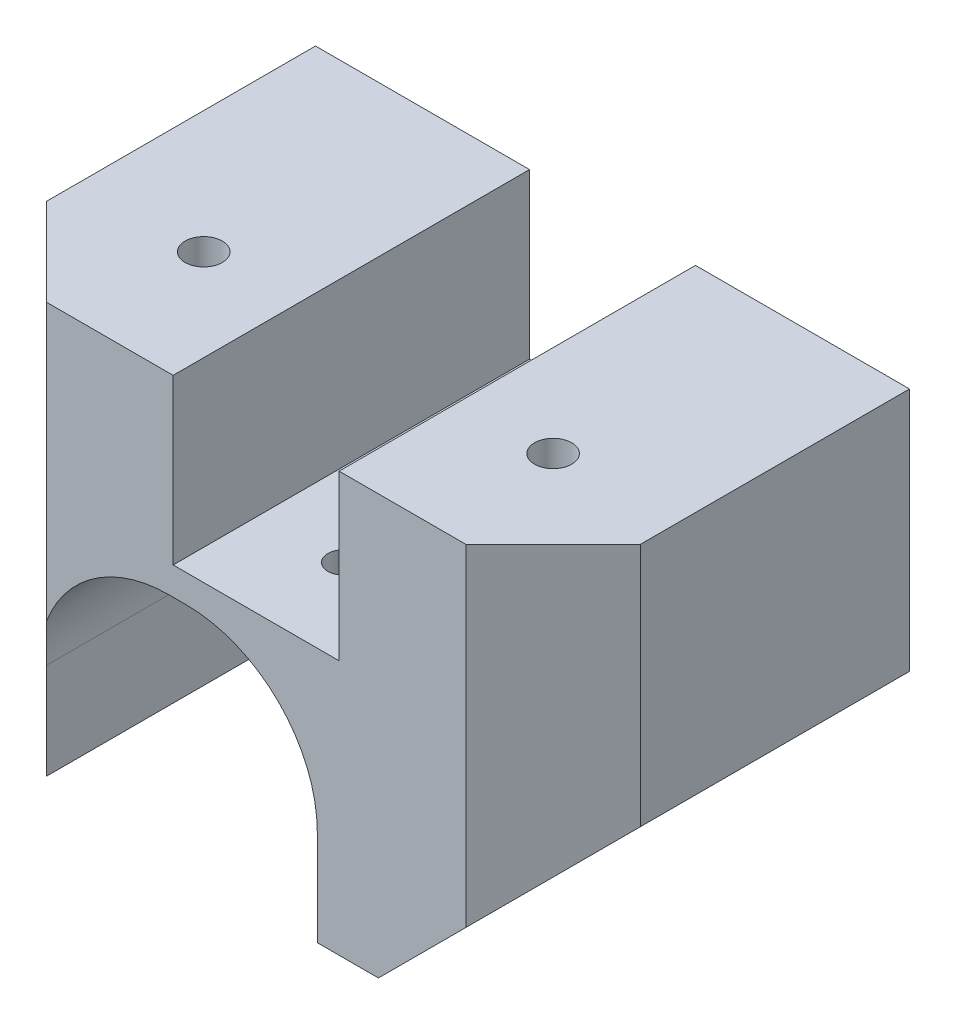
from build123d import *

# Parameters (mm, degrees)
SKETCH1_W                 = 43.18
SKETCH1_H                 = 25.908
BOSS_EXTRUDE1_DEPTH       = 30.48
SIDECHAMFER_SIZE          = 12.7
BACKCHAMFERS_SIZE         = 6.35
SKETCH2_W                 = 12.065
SKETCH2_H                 = 11.938
LINACTSLOT_DEPTH          = 46.457485236
MOUTINGHOLES_D            = 2.7051
MOUTINGHOLES_DEPTH        = 14.478
MOUTINGHOLES_TIP          = 0.81269403
CUT_EXTRUDE1_DEPTH        = 46.457485236
MOTORMOUNTINGHOLES2_D     = 2.2606
MOTORMOUNTINGHOLES2_DEPTH = 11.43
MOTORMOUNTINGHOLES2_TIP   = 0.679152758
GRIPPERSETSCREW_D         = 2.2606


with BuildPart() as part:
    # Sketch1 → Boss-Extrude1 (new body)
    with BuildSketch(Plane(origin=(0, 0, 0), x_dir=(1, 0, 0), z_dir=(0, 1, 0))):
        Rectangle(SKETCH1_W, SKETCH1_H)
    extrude(amount=BOSS_EXTRUDE1_DEPTH)

    # SideChamfer
    sidechamfer_edges = [part.edges().sort_by_distance(p)[0] for p in [
        (21.59, 0, 0),
    ]]
    chamfer(sidechamfer_edges, length=SIDECHAMFER_SIZE)

    # BackChamfers
    backchamfers_edges = [part.edges().sort_by_distance(p)[0] for p in [
        (-21.59, 15.24, 12.954),
        (21.59, 21.59, 12.954),
    ]]
    chamfer(backchamfers_edges, length=BACKCHAMFERS_SIZE)

    # Sketch2 → LinActSlot (cut, through all)
    with BuildSketch(Plane.XY.offset(12.954)):
        with Locations((0, 24.511)):
            Rectangle(SKETCH2_W, SKETCH2_H)
    extrude(amount=-LINACTSLOT_DEPTH, mode=Mode.SUBTRACT)

    # MoutingHoles
    with Locations(Plane(origin=(14.160350453, 30.48, 8.373414988), x_dir=(-1, 0, 0), z_dir=(0, 1, 0))):
        with Locations((1.460350453, -4.309414988), (26.860350453, -4.309414988)):
            Hole(MOUTINGHOLES_D / 2, depth=MOUTINGHOLES_DEPTH)
            with Locations((0, 0, -(MOUTINGHOLES_DEPTH + MOUTINGHOLES_TIP / 2))):  # 118° drill point
                Cone(0, MOUTINGHOLES_D / 2, MOUTINGHOLES_TIP, mode=Mode.SUBTRACT)

    # Sketch11 → Cut-Extrude1 (cut, through all)
    with BuildSketch(Plane(origin=(0, 0, -12.954), x_dir=(-1, 0, 0), z_dir=(0, 0, -1))):
        with BuildLine():
            Line((15.875, 6.35), (15.875, 6.985))
            ThreePointArc((15.875, 6.985), (13.085192091, 13.720192091), (6.35, 16.51))
            Line((6.35, 16.51), (5.08, 16.51))
            ThreePointArc((5.08, 16.51), (-1.655192091, 13.720192091), (-4.445, 6.985))
            Line((-4.445, 6.985), (-4.445, 6.35))
            Line((-4.445, 6.35), (-4.445, 0))
            Line((-4.445, 0), (15.875, 0))
            Line((15.875, 0), (15.875, 6.35))
        make_face()
    extrude(amount=-CUT_EXTRUDE1_DEPTH, mode=Mode.SUBTRACT)

    # MotorMountingHoles2
    with Locations(Plane(origin=(0, 0, -12.954), x_dir=(-1, 0, 0), z_dir=(0, 0, -1))):
        with Locations((18.2118, 6.985), (-6.7818, 6.985)):
            Hole(MOTORMOUNTINGHOLES2_D / 2, depth=MOTORMOUNTINGHOLES2_DEPTH)
            with Locations((0, 0, -(MOTORMOUNTINGHOLES2_DEPTH + MOTORMOUNTINGHOLES2_TIP / 2))):  # 118° drill point
                Cone(0, MOTORMOUNTINGHOLES2_D / 2, MOTORMOUNTINGHOLES2_TIP, mode=Mode.SUBTRACT)

    # GripperSetScrew (through all)
    with Locations(Plane(origin=(0, 18.542, 0), x_dir=(1, 0, 0), z_dir=(0, 1, 0))):
        with Locations((0, -6.604)):
            Hole(GRIPPERSETSCREW_D / 2)


solid = part.part
